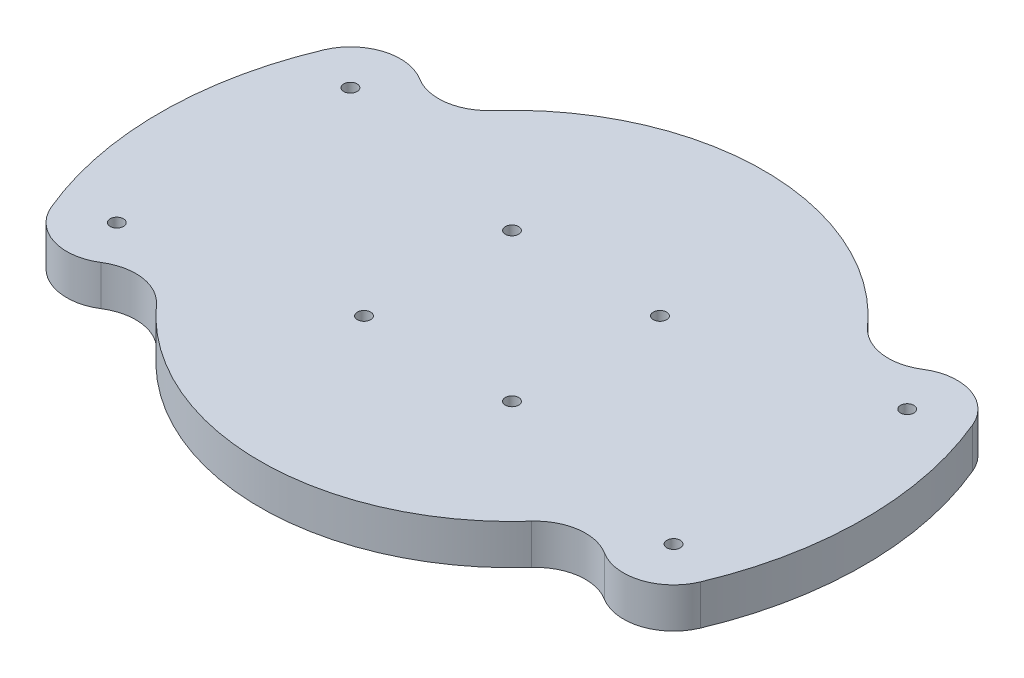
from build123d import *

# Parameters (mm, degrees)
SKETCH1_R           = 1
BOSS_EXTRUDE1_DEPTH = 6
FILLET1_R           = 7.5


with BuildPart() as part:
    # Sketch1 → Boss-Extrude1 (new body)
    with BuildSketch(Plane(origin=(0, 0, 0), x_dir=(1, 0, 0), z_dir=(0, 1, 0))):
        with BuildLine():
            Line((31.883633055, 20.164562188), (44.561021943, 28.182280752))
            ThreePointArc((44.561021943, 28.182280752), (52.725, 0), (44.561021943, -28.182280752))
            Line((44.561021943, -28.182280752), (31.883633055, -20.164562188))
            ThreePointArc((31.883633055, -20.164562188), (0, -37.725), (-31.883633055, -20.164562188))
            Line((-31.883633055, -20.164562188), (-44.561021943, -28.182280752))
            ThreePointArc((-44.561021943, -28.182280752), (-52.725, 0), (-44.561021943, 28.182280752))
            Line((-44.561021943, 28.182280752), (-31.883633055, 20.164562188))
            ThreePointArc((-31.883633055, 20.164562188), (0, 37.725), (31.883633055, 20.164562188))
        make_face()
        with Locations(Location((-11.083898795, 11.083898795, 0), (0, 0, 270))):
            Circle(SKETCH1_R, mode=Mode.SUBTRACT)
        with Locations(Location((11.083898795, 11.083898795, 0), (0, 0, 270))):
            Circle(SKETCH1_R, mode=Mode.SUBTRACT)
        with Locations(Location((11.083898795, -11.083898795, 0), (0, 0, 270))):
            Circle(SKETCH1_R, mode=Mode.SUBTRACT)
        with Locations(Location((-11.083898795, -11.083898795, 0), (0, 0, 270))):
            Circle(SKETCH1_R, mode=Mode.SUBTRACT)
        with Locations(Location((41.701925915, 17.5, 0), (0, 0, 270))):
            Circle(SKETCH1_R, mode=Mode.SUBTRACT)
        with Locations(Location((41.701925915, -17.5, 0), (0, 0, 270))):
            Circle(SKETCH1_R, mode=Mode.SUBTRACT)
        with Locations(Location((-41.701925915, 17.5, 0), (0, 0, 90))):
            Circle(SKETCH1_R, mode=Mode.SUBTRACT)
        with Locations(Location((-41.701925915, -17.5, 0), (0, 0, 90))):
            Circle(SKETCH1_R, mode=Mode.SUBTRACT)
    extrude(amount=BOSS_EXTRUDE1_DEPTH)

    # Fillet1
    fillet1_edges = [part.edges().sort_by_distance(p)[0] for p in [
        (44.561021943, 3, 28.182280752),
        (31.883633055, 3, 20.164562188),
        (-44.561021943, 3, 28.182280752),
        (-31.883633055, 3, 20.164562188),
        (44.561021943, 3, -28.182280752),
        (31.883633055, 3, -20.164562188),
        (-44.561021943, 3, -28.182280752),
        (-31.883633055, 3, -20.164562188),
    ]]
    fillet(fillet1_edges, radius=FILLET1_R - 0.0001)  # a hair under: the kernel refuses the full size


solid = part.part
